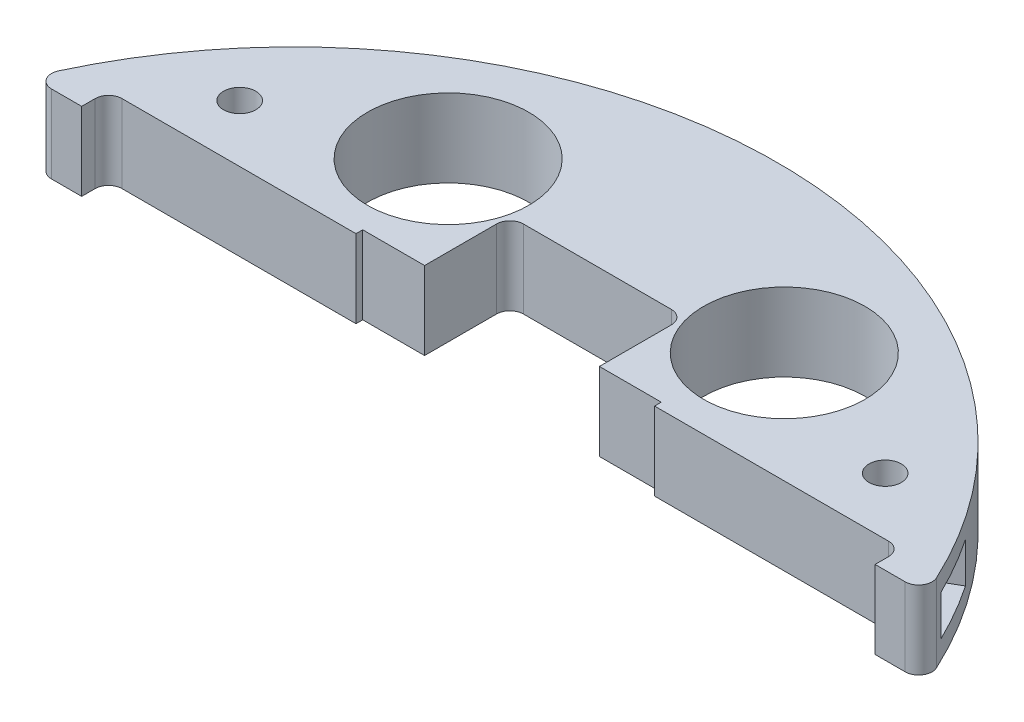
from build123d import *

# Parameters (mm, degrees)
BOSS_EXTRUDE1_DEPTH  = 5.8
SOLENOID_PLACEMENT_W = 38
SOLENOID_PLACEMENT_H = 64
CUT_EXTRUDE1_DEPTH   = 103.481998419
CUT_EXTRUDE4_DEPTH   = 103.481998419
SKETCH5_R            = 12
CUT_EXTRUDE5_DEPTH   = 103.481998419
SKETCH6_R            = 2.4
CUT_EXTRUDE6_DEPTH   = 103.481998419
CUT_EXTRUDE3_DEPTH   = 103.481998419
FILLET1_R            = 2
CUT_EXTRUDE7_DEPTH   = 3
SKETCH9_W            = 44.4
SKETCH9_H            = 65
CUT_EXTRUDE8_DEPTH   = 99.011383255


with BuildPart() as part:
    # Sketch1 → Boss-Extrude1 (new, symmetric)
    with BuildSketch(Plane(origin=(0, 0, 0), x_dir=(1, 0, 0), z_dir=(0, 1, 0))):
        with BuildLine():
            ThreePointArc((36.224522061, -62.223661106), (0, 72), (-36.224522061, -62.223661106))
            ThreePointArc((-36.224522061, -62.223661106), (-32.797800029, -62.818856853), (-29.811944095, -61.035223988))
            ThreePointArc((-29.811944095, -61.035223988), (0, -46.75), (29.811944095, -61.035223988))
            ThreePointArc((29.811944095, -61.035223988), (32.797800029, -62.818856853), (36.224522061, -62.223661106))
        make_face()
    extrude(amount=BOSS_EXTRUDE1_DEPTH, both=True)

    # solenoid placement → Cut-Extrude1 (cut, through all)
    with BuildSketch(Plane(origin=(0, 5.8, 0), x_dir=(1, 0, 0), z_dir=(0, 1, 0))):
        with Locations((0, -4)):
            Rectangle(SOLENOID_PLACEMENT_W, SOLENOID_PLACEMENT_H)
    extrude(amount=-CUT_EXTRUDE1_DEPTH, mode=Mode.SUBTRACT)

    # Sketch4 → Cut-Extrude4 (cut, through all)
    with BuildSketch(Plane(origin=(0, 5.8, 0), x_dir=(1, 0, 0), z_dir=(0, 1, 0))):
        with BuildLine():
            Line((-13, 28), (13, 28))
            Line((13, 28), (13, 43.2))
            ThreePointArc((13, 43.2), (12.414213562, 44.614213562), (11, 45.2))
            Line((11, 45.2), (-11, 45.2))
            ThreePointArc((-11, 45.2), (-12.414213562, 44.614213562), (-13, 43.2))
            Line((-13, 43.2), (-13, 28))
        make_face()
    extrude(amount=-CUT_EXTRUDE4_DEPTH, mode=Mode.SUBTRACT)

    # Sketch5 → Cut-Extrude5 (cut, through all)
    with BuildSketch(Plane(origin=(0, 5.8, 0), x_dir=(1, 0, 0), z_dir=(0, 1, 0))):
        with Locations((25, 48)):
            Circle(SKETCH5_R)
        with Locations((-25, 48)):
            Circle(SKETCH5_R)
    extrude(amount=-CUT_EXTRUDE5_DEPTH, mode=Mode.SUBTRACT)

    # Sketch6 → Cut-Extrude6 (cut, through all)
    with BuildSketch(Plane(origin=(0, 5.8, 0), x_dir=(1, 0, 0), z_dir=(0, 1, 0))):
        with Locations((48, 40)):
            Circle(SKETCH6_R)
        with Locations((-48, 40)):
            Circle(SKETCH6_R)
    extrude(amount=-CUT_EXTRUDE6_DEPTH, mode=Mode.SUBTRACT)

    # Sketch3 → Cut-Extrude3 (cut, through all)
    with BuildSketch(Plane(origin=(0, 5.8, 0), x_dir=(1, 0, 0), z_dir=(0, 1, 0))):
        Polygon((-19, 28), (19, 28), (19, 31.5), (59, 31.5), (59, 27.5), (72, 27.5), (72, -31.5), (72, -101.646422462), (-72, -101.646422462), (-72, -31.5), (-72, 27.5), (-59, 27.5), (-59, 31.5), (-19, 31.5), align=None)
    extrude(amount=-CUT_EXTRUDE3_DEPTH, mode=Mode.SUBTRACT)

    # Fillet1
    fillet1_edges = [part.edges().sort_by_distance(p)[0] for p in [
        (-66.541340534, 0, -27.5),
        (-59, 0, -31.5),
        (59, 0, -31.5),
        (66.541340534, 0, -27.5),
    ]]
    fillet(fillet1_edges, radius=FILLET1_R)

    # Sketch8 → Cut-Extrude7 (cut, symmetric)
    with BuildSketch(Plane(origin=(0, 0, 0), x_dir=(1, 0, 0), z_dir=(0, 1, 0))):
        with BuildLine():
            Line((5, 71.826179071), (5, 68.926179071))
            Line((5, 68.926179071), (-5, 68.926179071))
            Line((-5, 68.926179071), (-5, 71.826179071))
            ThreePointArc((-5, 71.826179071), (0, 72), (5, 71.826179071))
        make_face()
        with BuildLine():
            Line((64.703295733, 31.582962517), (62.191822062, 30.132962517))
            Line((62.191822062, 30.132962517), (57.191822062, 38.793216555))
            Line((57.191822062, 38.793216555), (59.703295733, 40.243216555))
            ThreePointArc((59.703295733, 40.243216555), (62.353829072, 36), (64.703295733, 31.582962517))
        make_face()
        with BuildLine():
            Line((-59.703295733, 40.243216555), (-57.191822062, 38.793216555))
            Line((-57.191822062, 38.793216555), (-62.191822062, 30.132962517))
            Line((-62.191822062, 30.132962517), (-64.703295733, 31.582962517))
            ThreePointArc((-64.703295733, 31.582962517), (-62.353829072, 36), (-59.703295733, 40.243216555))
        make_face()
    extrude(amount=CUT_EXTRUDE7_DEPTH, both=True, mode=Mode.SUBTRACT)

    # Sketch9 → Cut-Extrude8 (cut, through all)
    with BuildSketch(Plane(origin=(0, 5.8, 0), x_dir=(1, 0, 0), z_dir=(0, 1, 0))):
        Rectangle(SKETCH9_W, SKETCH9_H)
    extrude(amount=-CUT_EXTRUDE8_DEPTH, mode=Mode.SUBTRACT)


solid = part.part
